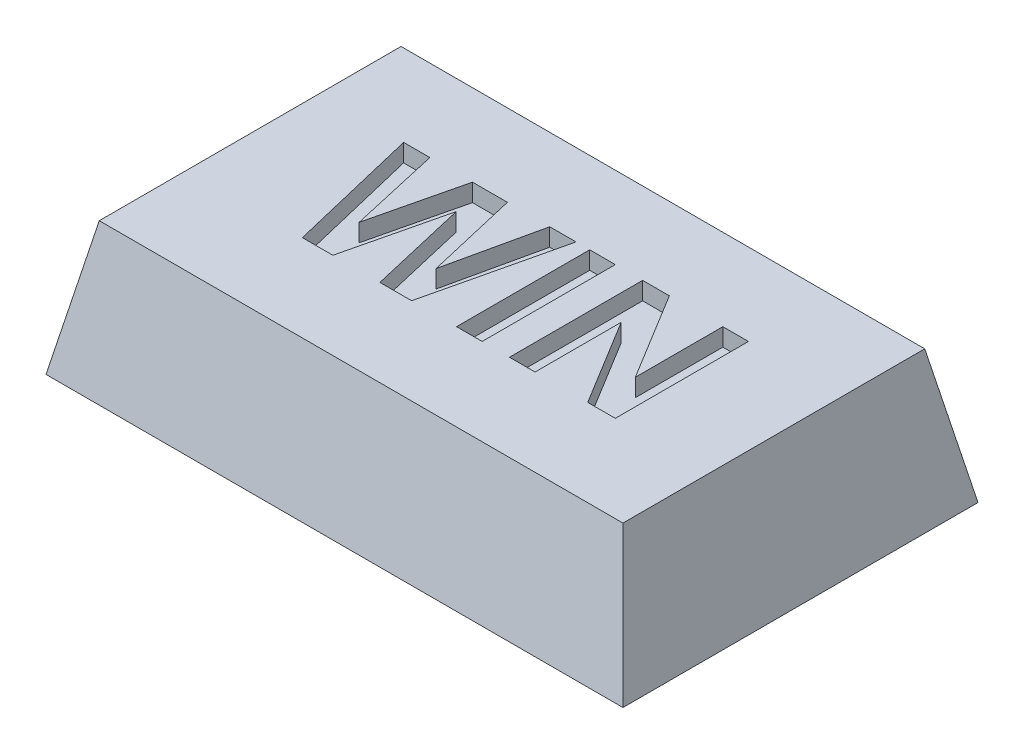
from build123d import *

# Parameters (mm, degrees)
SKETCH1_W               = 13
SKETCH1_H               = 8
BOSS_EXTRUDE1_DEPTH     = 3
CUT_EXTRUDE1_DEPTH      = 16.556349186
CUT_EXTRUDE1_DEPTH_BACK = 16.556349186
CUT_EXTRUDE2_DEPTH      = 16.556349186
CUT_EXTRUDE2_DEPTH_BACK = 16.556349186
SKETCH4_R               = 1.8
CUT_EXTRUDE3_DEPTH      = 0.8
SKETCH5_W               = 8
SKETCH5_H               = 1.1
BOSS_EXTRUDE2_DEPTH     = 2
FILLET1_R               = 4
SKETCH6_W               = 0.576923077
SKETCH6_H               = 3
CUT_EXTRUDE4_DEPTH      = 0.4


with BuildPart() as part:
    # Sketch1 → Boss-Extrude1 (new body)
    with BuildSketch(Plane(origin=(0, 0, 0), x_dir=(1, 0, 0), z_dir=(0, 1, 0))):
        with Locations((6.5, 4)):
            Rectangle(SKETCH1_W, SKETCH1_H)
    extrude(amount=BOSS_EXTRUDE1_DEPTH)

    # Sketch2 → Cut-Extrude1 (cut, two sides: drawn at the far end of the back side and taken through both)
    with BuildSketch(Plane.XY.offset(-CUT_EXTRUDE1_DEPTH_BACK)):
        Polygon((0, 0), (0.6, 3), (0, 3), align=None)
        Polygon((13, 0), (12.4, 3), (13, 3), align=None)
    extrude(amount=CUT_EXTRUDE1_DEPTH + CUT_EXTRUDE1_DEPTH_BACK, mode=Mode.SUBTRACT)

    # Sketch3 → Cut-Extrude2 (cut, two sides: drawn at the far end of the back side and taken through both)
    with BuildSketch(Plane(origin=(0, 0, 0), x_dir=(0, 0, -1), z_dir=(1, 0, 0)).offset(-CUT_EXTRUDE2_DEPTH_BACK)):
        Polygon((0, 0), (0.6, 3), (0, 3), align=None)
        Polygon((8, 3), (7.4, 3), (8, 0), align=None)
    extrude(amount=CUT_EXTRUDE2_DEPTH + CUT_EXTRUDE2_DEPTH_BACK, mode=Mode.SUBTRACT)

    # Sketch4 → Cut-Extrude3 (cut)
    with BuildSketch(Plane.XZ):
        with Locations(Location((6.50000125, -3.75, 0), (0, 0, 270))):
            Circle(SKETCH4_R)
    extrude(amount=-CUT_EXTRUDE3_DEPTH, mode=Mode.SUBTRACT)

    # Sketch5 → Boss-Extrude2 (add)
    with BuildSketch(Plane.XZ):
        with Locations((6.500011, -7.45)):
            Rectangle(SKETCH5_W, SKETCH5_H)
    extrude(amount=BOSS_EXTRUDE2_DEPTH)

    # Fillet1
    # the kernel refuses this fillet: 4 mm, written as the material it takes off along each edge
    with BuildSketch(Plane(origin=(10.500011, -2, -16.660254038), x_dir=(0, 1, 0), z_dir=(0, 0, 1)), Plane(origin=(2.500011, -2, 1.760254038), x_dir=(0, 1, 0), z_dir=(0, 0, -1))) as fillet1_piece_1:
        with BuildLine():
            CenterArc((4, 3.464101615), FILLET1_R, 180, 60)
            Line((0, 3.464101615), (-0.08, 3.464101615))
            Line((-0.08, 3.464101615), (-0.08, 0))
            Line((-0.08, 0), (0, -0.08))
            ThreePointArc((0, -0.08), (1, -0.08), (1.96, -0.069282032))
            Line((1.96, -0.069282032), (2, 0))
        make_face()
    extrude(amount=18.420508076, mode=Mode.SUBTRACT)

    # Sketch6 → Cut-Extrude4 (cut)
    with BuildSketch(Plane(origin=(0, 3, 0), x_dir=(1, 0, 0), z_dir=(0, 1, 0))):
        Polygon((3.219165588, 2.557267472), (2.50101655, 5.557267472), (3.092362704, 5.557267472), (3.558708858, 3.496570357), (4.052098281, 5.557267472), (4.839357896, 5.557267472), (5.327939627, 3.461714587), (5.793083858, 5.557267472), (6.385631934, 5.557267472), (5.68070405, 2.557267472), (4.966160781, 2.557267472), (4.443324242, 4.800055934), (3.906665588, 2.557267472), align=None)
        with Locations((6.981785781, 4.057267472)):
            Rectangle(SKETCH6_W, SKETCH6_H)
        Polygon((7.885631934, 2.557267472), (7.885631934, 5.557267472), (8.488396358, 5.557267472), (9.693324242, 3.584911703), (9.693324242, 5.557267472), (10.270247319, 5.557267472), (10.270247319, 2.557267472), (9.648853088, 2.557267472), (8.462555011, 4.498373241), (8.462555011, 2.557267472), align=None)
    extrude(amount=-CUT_EXTRUDE4_DEPTH, mode=Mode.SUBTRACT)


solid = part.part
